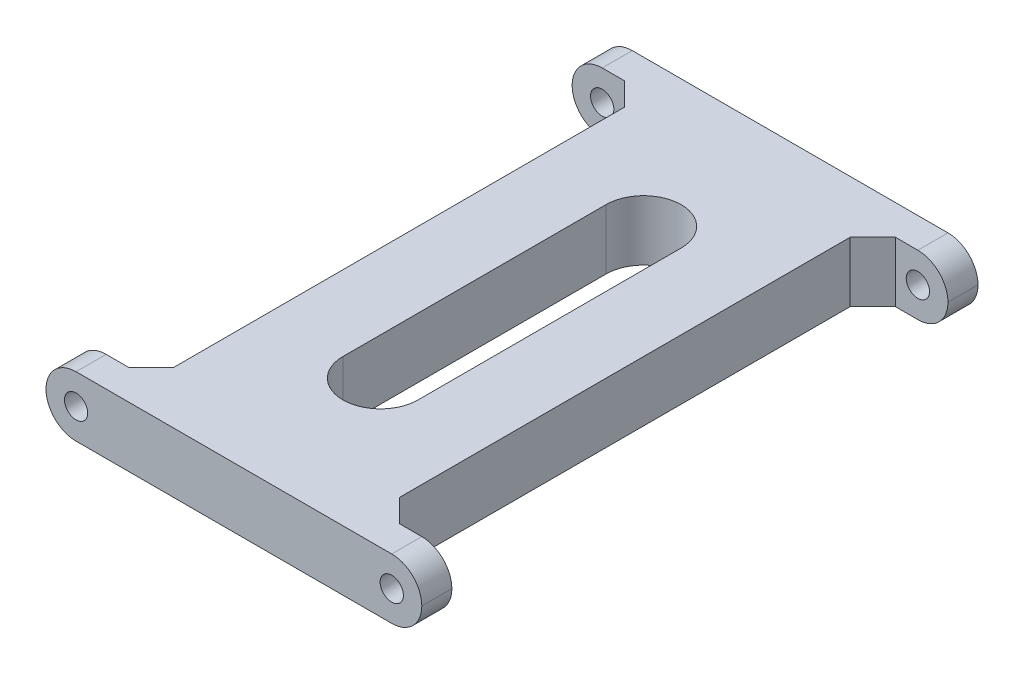
from build123d import *

# Parameters (mm, degrees)
BOSS_EXTRUDE1_DEPTH     = 4
CHAMFER1_SIZE           = 3
CUT_EXTRUDE1_DEPTH      = 45.833023543
CUT_EXTRUDE1_DEPTH_BACK = 45.833023543
SKETCH3_R               = 1.55
FILLET1_R               = 4


with BuildPart() as part:
    # Sketch1 → Boss-Extrude1 (new, symmetric)
    with BuildSketch(Plane(origin=(0, 0, 0), x_dir=(1, 0, 0), z_dir=(0, 1, 0))):
        Polygon((-25, 37), (25, 37), (25, 33), (15, 33), (15, -33), (25, -33), (25, -37), (-25, -37), (-25, -33), (-15, -33), (-15, 33), (-25, 33), align=None)
        with BuildLine():
            Line((-5, -17.5), (-5, 17.5))
            ThreePointArc((-5, 17.5), (0, 22.5), (5, 17.5))
            Line((5, 17.5), (5, -17.5))
            ThreePointArc((5, -17.5), (0, -22.5), (-5, -17.5))
        make_face(mode=Mode.SUBTRACT)
    extrude(amount=BOSS_EXTRUDE1_DEPTH, both=True)

    # Chamfer1
    chamfer1_edges = [part.edges().sort_by_distance(p)[0] for p in [
        (-15, 0, 33),
        (-15, 0, -33),
        (15, 0, -33),
        (15, 0, 33),
    ]]
    chamfer(chamfer1_edges, length=CHAMFER1_SIZE)

    # Sketch3 → Cut-Extrude1 (cut, two sides: drawn at the far end of the back side and taken through both)
    with BuildSketch(Plane.XY.offset(-CUT_EXTRUDE1_DEPTH_BACK)):
        with Locations((-21, 0)):
            Circle(SKETCH3_R)
        with Locations(Location((21, 0, 0), (0, 0, 180))):
            Circle(SKETCH3_R)
    extrude(amount=CUT_EXTRUDE1_DEPTH + CUT_EXTRUDE1_DEPTH_BACK, mode=Mode.SUBTRACT)

    # Fillet1
    fillet1_edges = [part.edges().sort_by_distance(p)[0] for p in [
        (25, -4, 35),
        (-25, -4, 35),
        (-25, 4, 35),
        (25, 4, 35),
        (25, -4, -35),
        (25, 4, -35),
        (-25, -4, -35),
        (-25, 4, -35),
    ]]
    fillet(fillet1_edges, radius=FILLET1_R - 0.0001)  # a hair under: the kernel refuses the full size


solid = part.part
